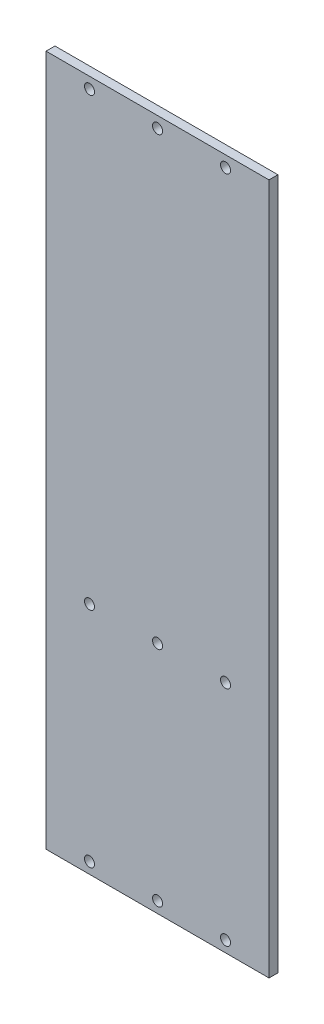
from build123d import *

# Parameters (mm, degrees)
SCHIZZO1_W                   = 100
SCHIZZO1_H                   = 310
SCHIZZO1_R                   = 2.25
ESTRUSIONE_ESTRUSIONE1_DEPTH = 4


with BuildPart() as part:
    # Schizzo1 → Estrusione-Estrusione1 (new body)
    with BuildSketch(Plane.XY):
        with Locations((50, 155)):
            Rectangle(SCHIZZO1_W, SCHIZZO1_H)
        with Locations((80.5, 5)):
            Circle(SCHIZZO1_R, mode=Mode.SUBTRACT)
        with Locations((50, 5)):
            Circle(SCHIZZO1_R, mode=Mode.SUBTRACT)
        with Locations((19.5, 5)):
            Circle(SCHIZZO1_R, mode=Mode.SUBTRACT)
        with Locations((19.5, 305)):
            Circle(SCHIZZO1_R, mode=Mode.SUBTRACT)
        with Locations((50, 305)):
            Circle(SCHIZZO1_R, mode=Mode.SUBTRACT)
        with Locations((80.5, 305)):
            Circle(SCHIZZO1_R, mode=Mode.SUBTRACT)
        with Locations((50, 105)):
            Circle(SCHIZZO1_R, mode=Mode.SUBTRACT)
        with Locations((80.5, 105)):
            Circle(SCHIZZO1_R, mode=Mode.SUBTRACT)
        with Locations((19.5, 105)):
            Circle(SCHIZZO1_R, mode=Mode.SUBTRACT)
    extrude(amount=-ESTRUSIONE_ESTRUSIONE1_DEPTH)


solid = part.part
